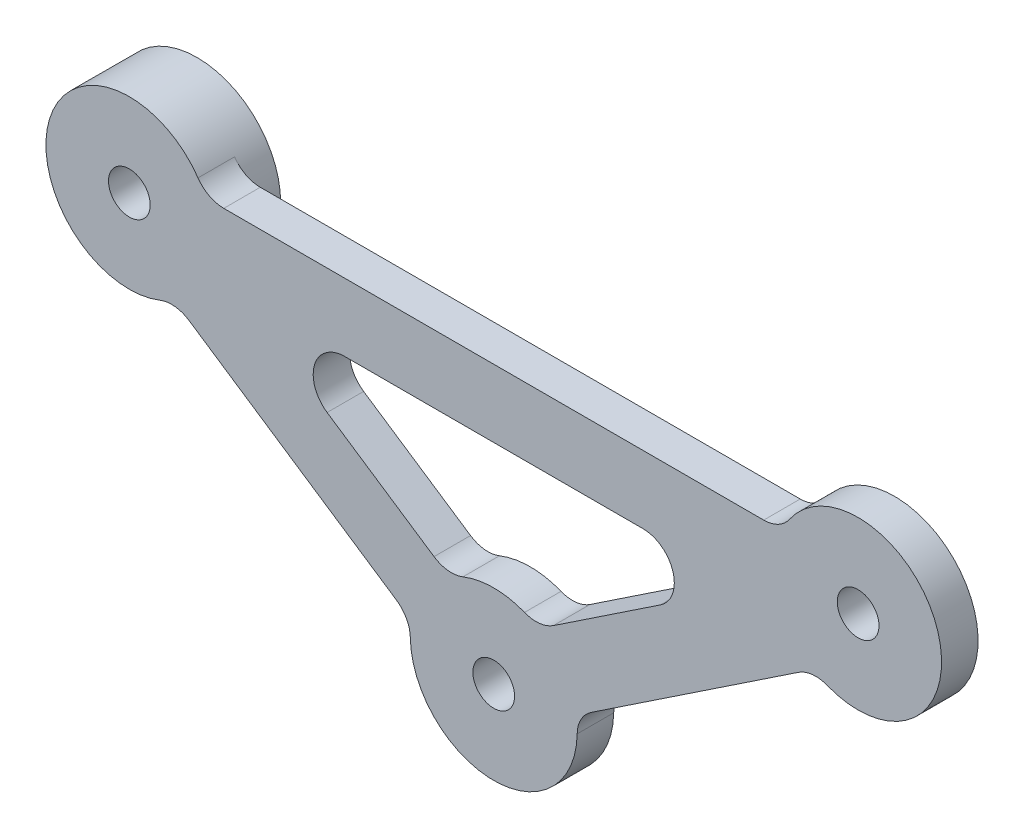
from build123d import *

# Parameters (mm, degrees)
SKETCH1_R             = 8
SKETCH1_R_2           = 2
BOSS_EXTRUDE1_DEPTH   = 3.5
BOSS_EXTRUDE1_2_DEPTH = 3.5
BOSS_EXTRUDE1_3_DEPTH = 3.5
SKETCH4_W             = 60
SKETCH4_H             = 6.5
EXTRUDE_THIN1_DEPTH   = 3.5
FILLET1_R             = 3
SKETCH_1_R            = 8
SKETCH_1_R_2          = 2
EXTRUDE_1_DEPTH       = 3
FILLET_2_R            = 3


with BuildPart() as part:
    # Sketch1 → Boss-Extrude1 (new body)
    with BuildSketch(Plane.XY):
        with Locations((-29.621497739, -38.307799929)):
            Circle(SKETCH1_R)
        with Locations((-29.621497739, -38.307799929)):
            Circle(SKETCH1_R_2, mode=Mode.SUBTRACT)
    extrude(amount=-BOSS_EXTRUDE1_DEPTH)



with BuildPart() as body_2:
    # Sketch1 → Boss-Extrude1 2 (new body)
    with BuildSketch(Plane.XY):
        with Locations((40.247017363, -38.307799929)):
            Circle(SKETCH1_R)
        with Locations((40.247017363, -38.307799929)):
            Circle(SKETCH1_R_2, mode=Mode.SUBTRACT)
    extrude(amount=-BOSS_EXTRUDE1_2_DEPTH)


with BuildPart() as body_3:
    # Sketch1 → Boss-Extrude1 3 (new body)
    with BuildSketch(Plane.XY):
        with Locations((5.312759812, -61.622980593)):
            Circle(SKETCH1_R)
        with Locations((5.312759812, -61.622980593)):
            Circle(SKETCH1_R_2, mode=Mode.SUBTRACT)
    extrude(amount=-BOSS_EXTRUDE1_3_DEPTH)


with BuildPart() as part_1:
    add(part.part)

    add(body_2.part)  # Extrude-Thin1 merges body 2

    add(body_3.part)  # Extrude-Thin1 merges body 3
    # Sketch4 → Extrude-Thin1 (add)
    with BuildSketch(Plane.XY):
        with Locations((5.312759812, -38.307799929)):
            Rectangle(SKETCH4_W, SKETCH4_H)
        Polygon((-26.435040402, -44.341786144), (-1.481999294, -60.995486618), (2.126302475, -55.588994378), (-22.826738632, -38.935293904), align=None)
        Polygon((12.107518918, -60.995486618), (37.060560026, -44.341786144), (33.452258256, -38.935293904), (8.499217149, -55.588994378), align=None)
    extrude(amount=-EXTRUDE_THIN1_DEPTH)

    # Fillet1
    fillet1_edges = [part_1.edges().sort_by_distance(p)[0] for p in [
        (-18.897311611, -41.557799929, -1.75),
        (1.036606698, -54.861729633, -1.75),
        (9.588912926, -54.861729633, -1.75),
        (29.522831235, -41.557799929, -1.75),
    ]]
    fillet(fillet1_edges, radius=FILLET1_R)

    # 草图1 → 凸台-拉伸1 (add)
    with BuildSketch(Plane(origin=(0, 0, -3.5), x_dir=(-1, 0, 0), z_dir=(0, 0, -1))):
        with Locations(Location((29.621497739, -38.307799929, 0), (0, 0, 156.030517682))):
            Circle(SKETCH_1_R)
        with Locations(Location((29.621497739, -38.307799929, 0), (0, 0, 180))):
            Circle(SKETCH_1_R_2, mode=Mode.SUBTRACT)
    extrude(amount=EXTRUDE_1_DEPTH)

    # 圆角2
    # the kernel refuses this fillet: 3 mm, written as the material it adds along each edge
    with BuildSketch(Plane(origin=(-22.31140198, -35.057799929, -3.5), x_dir=(1, 0, 0), z_dir=(0, 0, 1)), Plane(origin=(-2.571695072, -60.268221873, -3.5), x_dir=(-0.8317680369208076, 0.5551233491368437, 0), z_dir=(0, 0, 1)), Plane(origin=(35.970864249, -45.069050889, -3.5), x_dir=(-0.8317680369208071, -0.5551233491368445, 0), z_dir=(0, 0, 1))) as fillet_2_piece_1:
        with BuildLine():
            CenterArc((1.741837737, 3), FILLET_2_R, 214.623535479, 55.376464521)
            ThreePointArc((-0.726871399, 1.295454545), (-0.333303043, 0.664634517), (0, 0))
            Line((0, 0), (1.741837737, 0))
        make_face()
    extrude(amount=3.5)
    with BuildSketch(Plane(origin=(32.936921604, -35.057799929, -3.5), x_dir=(0.4893293145989847, 0.8720990894812859, 0), z_dir=(0, 0, 1)), Plane(origin=(-25.345344625, -45.069050889, -3.5), x_dir=(-0.8911310507438419, -0.45374601970725476, 0), z_dir=(0, 0, 1))) as fillet_2_piece_2:
        with BuildLine():
            CenterArc((1.763965003, 2.987043048), FILLET_2_R, 209.296508898, 55.376464521)
            Line((-0.852332266, 1.519055104), (0, 0))
            ThreePointArc((0, 0), (0.742722106, 0.034551872), (1.485444213, 0))
        make_face()
    extrude(amount=3.5)
    with BuildSketch(Plane(origin=(13.197214696, -60.268221873, -3.5), x_dir=(0.8317680369208036, 0.5551233491368496, 0), z_dir=(0, 0, 1))) as fillet_2_piece_3:
        with BuildLine():
            CenterArc((1.741837737, -3), FILLET_2_R, 90, 55.376464521)
            ThreePointArc((-0.726871399, -1.295454545), (-0.333303043, -0.664634517), (0, 0))
            Line((0, 0), (1.741837737, 0))
        make_face()
    extrude(amount=3.5)


solid = part_1.part
